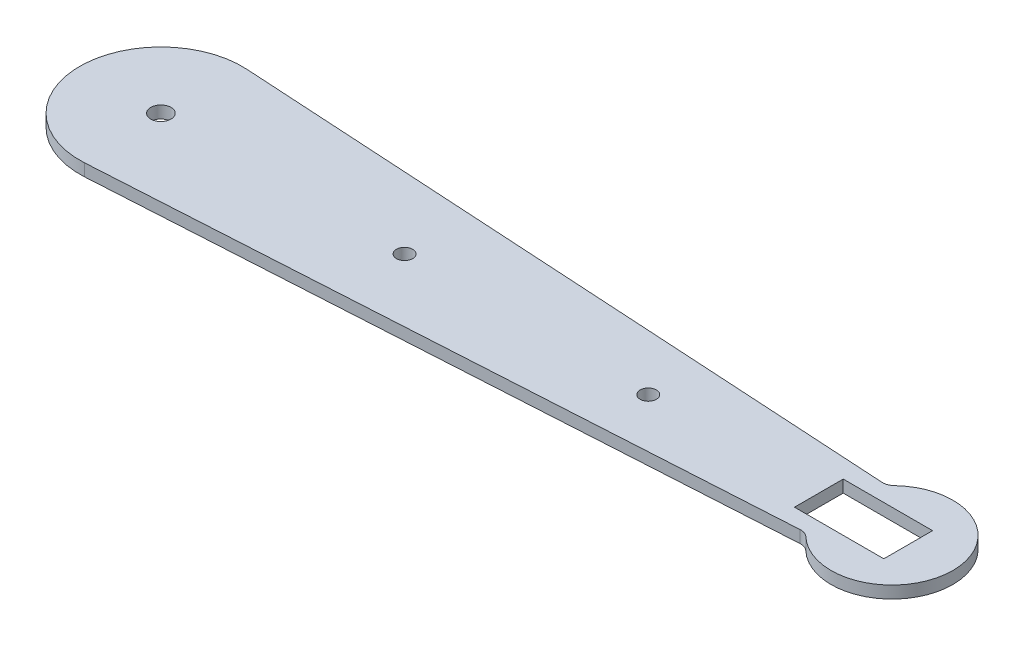
from build123d import *

# Parameters (mm, degrees)
SKETCH1_R           = 2.5
SKETCH1_R_2         = 2
BOSS_EXTRUDE1_DEPTH = 3
FILLET2_R           = 3
FILLET3_R           = 3
SKETCH2_W           = 22
SKETCH2_H           = 12
CUT_EXTRUDE1_DEPTH  = 10


with BuildPart() as part:
    # Sketch1 → Boss-Extrude1 (new body)
    with BuildSketch(Plane(origin=(0, 0, 0), x_dir=(1, 0, 0), z_dir=(0, 1, 0))):
        with BuildLine():
            ThreePointArc((1.186783721, 19.964757559), (-20, 0), (1.186783721, -19.964757559))
            Line((1.186783721, -19.964757559), (168.819660113, -10))
            ThreePointArc((168.819660113, -10), (195, 0), (168.819660113, 10))
            Line((168.819660113, 10), (1.186783721, 19.964757559))
        make_face()
        Circle(SKETCH1_R, mode=Mode.SUBTRACT)
        with Locations((60, 0)):
            Circle(SKETCH1_R_2, mode=Mode.SUBTRACT)
        with Locations((120, 0)):
            Circle(SKETCH1_R_2, mode=Mode.SUBTRACT)
    extrude(amount=BOSS_EXTRUDE1_DEPTH)

    # Fillet2
    fillet2_edges = [part.edges().sort_by_distance(p)[0] for p in [
        (168.819660113, 1.5, -10),
    ]]
    fillet(fillet2_edges, radius=FILLET2_R)

    # Fillet3
    fillet3_edges = [part.edges().sort_by_distance(p)[0] for p in [
        (168.819660113, 1.5, 10),
    ]]
    fillet(fillet3_edges, radius=FILLET3_R)

    # Sketch2 → Cut-Extrude1 (cut)
    with BuildSketch(Plane(origin=(0, 3, 0), x_dir=(1, 0, 0), z_dir=(0, 1, 0))):
        with Locations((173, 0)):
            Rectangle(SKETCH2_W, SKETCH2_H)
    extrude(amount=-CUT_EXTRUDE1_DEPTH, mode=Mode.SUBTRACT)


solid = part.part
